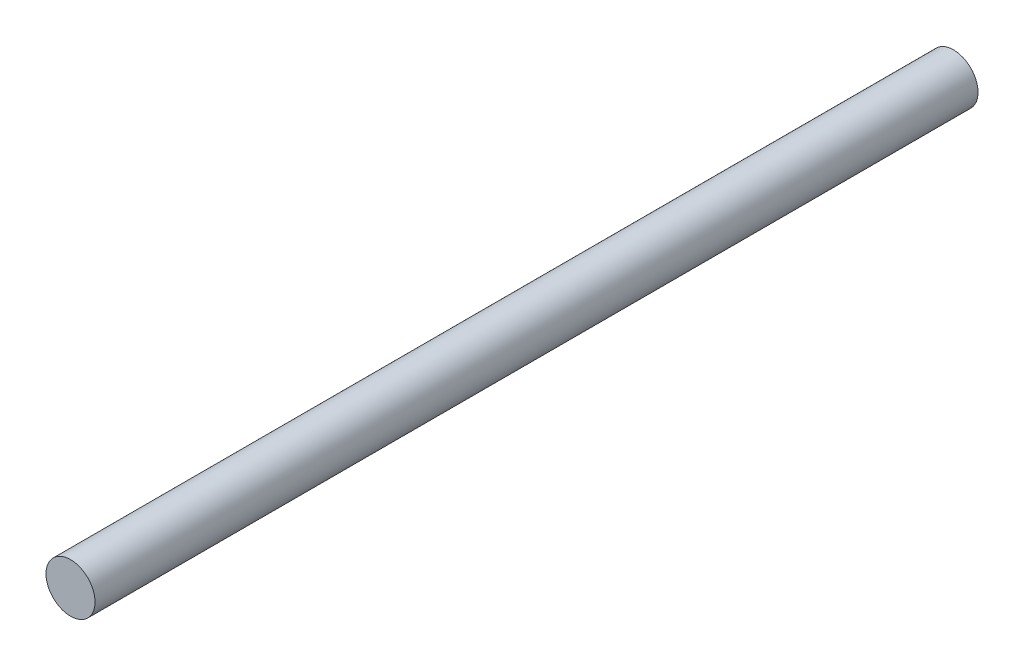
from build123d import *

# Parameters (mm, degrees)
SKETCH1_R           = 2.5
BOSS_EXTRUDE1_DEPTH = 90


with BuildPart() as part:
    # Sketch1 → Boss-Extrude1 (new body)
    with BuildSketch(Plane.XY):
        Circle(SKETCH1_R)
    extrude(amount=BOSS_EXTRUDE1_DEPTH)


solid = part.part
